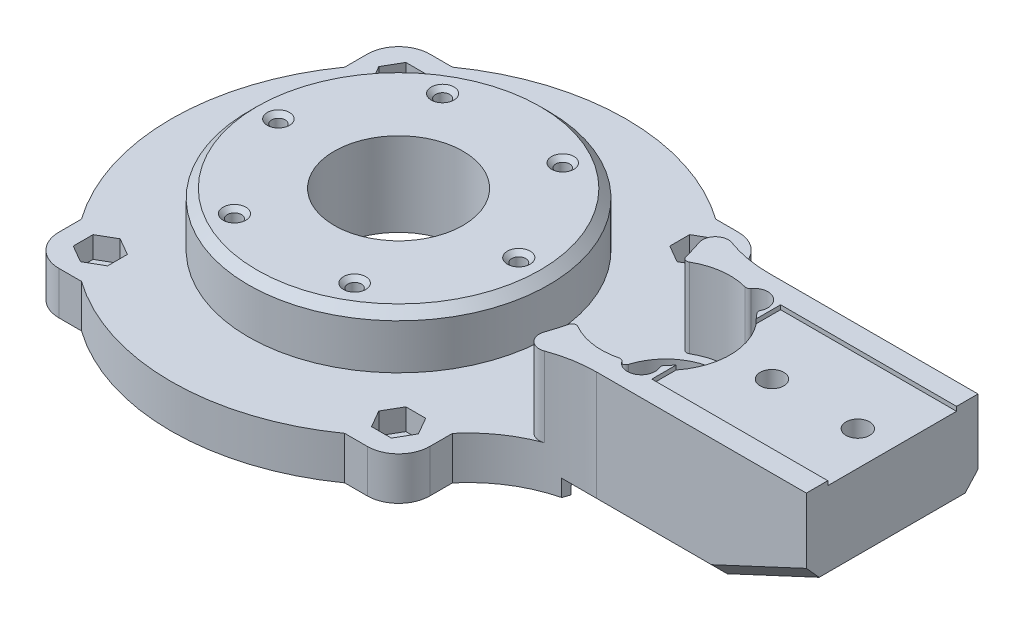
from build123d import *

# Parameters (mm, degrees)
SKETCH3_R           = 62.5
BOSS_EXTRUDE3_DEPTH = 10
BOSS_EXTRUDE4_START = -10
BOSS_EXTRUDE4_DEPTH = 10
BOSS_EXTRUDE5_DEPTH = 18.5
CHAMFER1_SIZE       = 10
CHAMFER1_SIZE2      = 21.445069205095713
SKETCH21_R          = 13.000000000000044
CUT_EXTRUDE12_DEPTH = 65.99999999999999
CUT_EXTRUDE14_DEPTH = 41
SKETCH26_R          = 2.750000000000008
CUT_EXTRUDE15_DEPTH = 134.9533500887529
SKETCH27_R          = 4.600000000000013
SKETCH27_R_2        = 4.5999999999999845
CUT_EXTRUDE16_DEPTH = 14
CHAMFER3_SIZE       = 3
SKETCH43_R          = 1.7499999999999962
SKETCH43_R_2        = 1.7499999999999967
SKETCH43_R_3        = 1.749999999999997
CUT_EXTRUDE22_DEPTH = 42.00000000000001
SKETCH44_R          = 3.000000000000008
CUT_EXTRUDE23_DEPTH = 4.99999999999998
SKETCH49_R          = 3.250000000000007
SKETCH49_R_2        = 3.250000000000008
CUT_EXTRUDE28_DEPTH = 23.000000000000007
FILLET4_R           = 1
CHAMFER6_SIZE       = 1
SKETCH53_R          = 35.00000000000001
BOSS_EXTRUDE7_DEPTH = 12.5
SKETCH54_R          = 2.750000000000002
CUT_EXTRUDE29_DEPTH = 134.953350156687
CHAMFER7_SIZE       = 2
FILLET6_R           = 1
SKETCH66_R          = 14.999999999999998
CUT_EXTRUDE39_DEPTH = 18.5
CUT_EXTRUDE40_DEPTH = 134.953350156687
FILLET8_R           = 30
FILLET9_R           = 3
FILLET10_R          = 1
SKETCH68_R          = 19.500000000000004
CUT_EXTRUDE41_DEPTH = 2
SKETCH70_R          = 37
CUT_EXTRUDE42_DEPTH = 3
SKETCH71_R          = 14.999999999999998
CUT_EXTRUDE43_DEPTH = 130.7931047448207
SKETCH73_R          = 1.6000000000000016
SKETCH73_R_2        = 1.6000000000000023
SKETCH73_R_3        = 1.600000000000003
CUT_EXTRUDE44_DEPTH = 6
SKETCH74_R          = 1.6499999999999986
CUT_EXTRUDE45_DEPTH = 129.60890341690967
CUT_EXTRUDE46_DEPTH = 14
CIRPATTERN1_COUNT   = 3
CHAMFER8_SIZE       = 1
CUT_EXTRUDE47_DEPTH = 5
CIRPATTERN2_COUNT   = 4
CHAMFER9_SIZE       = 1


with BuildPart() as part:
    # Sketch3 → Boss-Extrude3 (new body)
    with BuildSketch(Plane.XZ):
        with Locations(Location((0, 0, 0), (0, 0, 270))):
            Circle(SKETCH3_R)
    extrude(amount=BOSS_EXTRUDE3_DEPTH)

    # Sketch19 → Boss-Extrude4 (add)
    with BuildSketch(Plane.XZ.offset(10).offset(BOSS_EXTRUDE4_START)):
        with BuildLine():
            Line((59.21359641163505, -20), (115, -20))
            Line((115, -20), (115, 20))
            Line((115, 20), (59.21359641163505, 20))
            ThreePointArc((59.21359641163505, 20), (62.49999999999999, 0), (59.21359641163505, -20))
        make_face()
    extrude(amount=BOSS_EXTRUDE4_DEPTH)

    # Sketch20 → Boss-Extrude5 (add)
    with BuildSketch(Plane(origin=(0, 0, 0), x_dir=(1, 0, 0), z_dir=(0, 1, 0))):
        with BuildLine():
            Line((51.234753829797995, -20), (115, -20))
            Line((115, -20), (115, 20))
            Line((115, 20), (51.234753829797995, 20))
            ThreePointArc((51.234753829797995, 20), (55, 0), (51.234753829797995, -20))
        make_face()
    extrude(amount=BOSS_EXTRUDE5_DEPTH)

    # Chamfer1
    chamfer1_edges = [part.edges().sort_by_distance(p)[0] for p in [
        (115, -10, 0),
    ]]
    chamfer1_side = [part.faces().sort_by_distance(p)[0] for p in [
        (115, 4.249999999999999, -3e-17),
    ]]
    chamfer(chamfer1_edges, length=CHAMFER1_SIZE, length2=CHAMFER1_SIZE2, reference=chamfer1_side[0])

    # Sketch21 → Cut-Extrude12 (cut)
    with BuildSketch(Plane.XZ.offset(10)):
        with Locations(Location((62.250000000000114, -8.91e-15, 0), (0, 0, 270))):
            Circle(SKETCH21_R)
    extrude(amount=-CUT_EXTRUDE12_DEPTH, mode=Mode.SUBTRACT)

    # Sketch25 → Cut-Extrude14 (cut)
    with BuildSketch(Plane(origin=(115, 0, 0), x_dir=(0, 0, -1), z_dir=(1, 0, 0))):
        Polygon((15.00000000000001, 19.500000000000004), (-14.99999999999999, 19.499999999999996), (-14.99999999999999, 17.499999999999996), (15.00000000000001, 17.5), align=None)
    extrude(amount=-CUT_EXTRUDE14_DEPTH, mode=Mode.SUBTRACT)

    # Sketch26 → Cut-Extrude15 (cut, through all)
    with BuildSketch(Plane.XZ.offset(10)):
        with Locations(Location((107.00000000000001, 0, 0), (0, 0, 270))):
            Circle(SKETCH26_R)
        with Locations(Location((87.00000000000001, -3.43e-15, 0), (0, 0, 270))):
            Circle(SKETCH26_R)
    extrude(amount=-CUT_EXTRUDE15_DEPTH, mode=Mode.SUBTRACT)

    # Sketch27 → Cut-Extrude16 (cut)
    with BuildSketch(Plane.XZ.offset(10)):
        with Locations(Location((87.00000000000001, -3.43e-15, 0), (0, 0, 270))):
            Circle(SKETCH27_R)
        with Locations(Location((107.00000000000001, 0, 0), (0, 0, 270))):
            Circle(SKETCH27_R_2)
    extrude(amount=-CUT_EXTRUDE16_DEPTH, mode=Mode.SUBTRACT)

    # Chamfer3
    chamfer3_edges = [part.edges().sort_by_distance(p)[0] for p in [
        (76.38426360326967, -10, 20),
        (104.27746539745215, -5.000000000000005, 19.999999999999996),
        (104.27746539745215, -4.999999999999995, -20),
        (76.38426360326967, -10, -20),
    ]]
    chamfer(chamfer3_edges, length=CHAMFER3_SIZE)

    # Sketch43 → Cut-Extrude22 (cut)
    with BuildSketch(Plane.XZ.offset(15)):
        with Locations(Location((47.2508869107844, -0.16311510311927524, 0), (0, 0, 270))):
            Circle(SKETCH43_R)
        with Locations(Location((69.6080513242215, 13.071307536358828, 0), (0, 0, 270))):
            Circle(SKETCH43_R_2)
        with Locations(Location((69.89081836764976, -12.90805541793711, 0), (0, 0, 270))):
            Circle(SKETCH43_R_3)
    extrude(amount=-CUT_EXTRUDE22_DEPTH, mode=Mode.SUBTRACT)

    # Sketch44 → Cut-Extrude23 (cut)
    with BuildSketch(Plane(origin=(0, 0, 0), x_dir=(1, 0, 0), z_dir=(0, 1, 0))):
        with Locations((69.89081836764976, 12.90805541793711)):
            Circle(SKETCH44_R)
    extrude(amount=-CUT_EXTRUDE23_DEPTH, mode=Mode.SUBTRACT)

    # Sketch49 → Cut-Extrude28 (cut)
    with BuildSketch(Plane(origin=(0, 18.5, 0), x_dir=(1, 0, 0), z_dir=(0, 1, 0))):
        with Locations((69.6080513242215, -13.071307536358828)):
            Circle(SKETCH49_R)
        with Locations((47.2508869107844, 0.16311510311927524)):
            Circle(SKETCH49_R_2)
        with Locations((69.89081836764976, 12.90805541793711)):
            Circle(SKETCH49_R)
    extrude(amount=-CUT_EXTRUDE28_DEPTH, mode=Mode.SUBTRACT)

    # Fillet4
    fillet4_edges = [part.edges().sort_by_distance(p)[0] for p in [
        (49.49533004411492, -2.2500000000000036, -2.513641644395821),
        (49.443681399677665, -2.2500000000000036, 2.2356663228300255),
    ]]
    fillet(fillet4_edges, radius=FILLET4_R)

    # Chamfer6
    # the kernel refuses this chamfer: 1 mm, written as the material it takes off along each edge
    with BuildSketch(Plane(origin=(69.89081836764976, -4.999999999999979, -12.90805541793711), x_dir=(0, 0, -1), z_dir=(-1, 0, 0))) as chamfer6_piece_1:
        Polygon((1.7499999999999964 + CHAMFER6_SIZE, 8.9e-16), (1.7499999999999964, CHAMFER6_SIZE), (1.7499999999999964, 0), align=None)
    revolve(axis=Axis((69.89081836764976, -4.999999999999979, -12.90805541793711), (0, -1, 0)), mode=Mode.SUBTRACT)
    with BuildSketch(Plane(origin=(69.6080513242215, -4.500000000000007, 13.071307536358828), x_dir=(0, 0, -1), z_dir=(-1, 0, 0))) as chamfer6_piece_2:
        Polygon((1.7499999999999964, CHAMFER6_SIZE), (1.7499999999999964 + CHAMFER6_SIZE, 0), (1.7499999999999964, 0), align=None)
    revolve(axis=Axis((69.6080513242215, -4.500000000000007, 13.071307536358828), (0, -1, 0)), mode=Mode.SUBTRACT)
    with BuildSketch(Plane(origin=(47.2508869107844, -4.500000000000007, -0.16311510311927524), x_dir=(0, 0, -1), z_dir=(-1, 0, 0))) as chamfer6_piece_3:
        Polygon((1.7499999999999962 + CHAMFER6_SIZE, 0), (1.7499999999999962, CHAMFER6_SIZE), (1.7499999999999962, 0), align=None)
    revolve(axis=Axis((47.2508869107844, -4.500000000000007, -0.16311510311927524), (0, -1, 0)), mode=Mode.SUBTRACT)

    # Sketch53 → Boss-Extrude7 (add)
    with BuildSketch(Plane(origin=(0, 0, 0), x_dir=(1, 0, 0), z_dir=(0, 1, 0))):
        with Locations(Location((0, 0, 0), (0, 0, 90))):
            Circle(SKETCH53_R)
    extrude(amount=BOSS_EXTRUDE7_DEPTH)

    # Sketch54 → Cut-Extrude29 (cut, through all)
    with BuildSketch(Plane.XZ.offset(10)):
        with Locations(Location((-34.75000000000001, 34.75000000000001, 0), (0, 0, 270))):
            Circle(SKETCH54_R)
        with Locations(Location((34.74999999999999, 34.75000000000001, 0), (0, 0, 270))):
            Circle(SKETCH54_R)
        with Locations(Location((34.75, -34.74999999999999, 0), (0, 0, 270))):
            Circle(SKETCH54_R)
        with Locations(Location((-34.75, -34.74999999999999, 0), (0, 0, 270))):
            Circle(SKETCH54_R)
    extrude(amount=-CUT_EXTRUDE29_DEPTH, mode=Mode.SUBTRACT)

    # Chamfer7
    chamfer7_edges = [part.edges().sort_by_distance(p)[0] for p in [
        (-6.43e-15, 12.5, 35.00000000000001),
    ]]
    chamfer(chamfer7_edges, length=CHAMFER7_SIZE)

    # Fillet6
    fillet6_edges = [part.edges().sort_by_distance(p)[0] for p in [
        (66.45022837085345, 6.9999999999999964, 12.302767234759814),
        (70.58911742750864, 6.9999999999999964, 9.972919358453899),
        (70.80421249799967, 6.9999999999999964, -9.789047376485088),
        (66.71701547020479, 6.9999999999999964, -12.20843039825159),
    ]]
    fillet(fillet6_edges, radius=FILLET6_R)

    # Sketch66 → Cut-Extrude39 (cut)
    with BuildSketch(Plane(origin=(0, 18.5, 0), x_dir=(1, 0, 0), z_dir=(0, 1, 0))):
        with Locations((62.250000000000114, 8.91e-15)):
            Circle(SKETCH66_R)
    extrude(amount=-CUT_EXTRUDE39_DEPTH, mode=Mode.SUBTRACT)

    # Sketch67 → Cut-Extrude40 (cut, through all)
    with BuildSketch(Plane.XZ.offset(10)):
        with BuildLine():
            Line((-35.92500000000098, -43.22499999999998), (-30.669192604305767, -43.22499999999997))
            ThreePointArc((-30.669192604305767, -43.22499999999997), (3.25e-15, -53.00000000000001), (30.669192604305774, -43.22499999999997))
            Line((30.669192604305774, -43.22499999999997), (35.92499999999899, -43.22499999999997))
            ThreePointArc((35.92499999999899, -43.22499999999997), (41.086879502661006, -41.0868795026617), (43.224999999999035, -35.9249999999997))
            Line((43.224999999999035, -35.9249999999997), (43.224999999999035, -30.669192604307092))
            ThreePointArc((43.224999999999035, -30.669192604307092), (46.460557384610766, -25.503266604717343), (49.08156476723212, -20))
            Line((49.08156476723212, -20), (59.21359641163505, -20))
            ThreePointArc((59.21359641163505, -20), (-62.49999999999999, 3.541e-14), (59.21359641163505, 19.99999999999999))
            Line((59.21359641163505, 19.99999999999999), (51.23475382979799, 19.999999999999993))
            Line((51.23475382979799, 19.999999999999993), (49.08156476723212, 20))
            ThreePointArc((49.08156476723212, 20), (46.460557384610766, 25.503266604717357), (43.224999999999035, 30.669192604307113))
            Line((43.224999999999035, 30.669192604307113), (43.22499999999903, 35.924999999999955))
            ThreePointArc((43.22499999999903, 35.924999999999955), (41.086879502660835, 41.08687950266181), (35.92499999999899, 43.2250000000001))
            Line((35.92499999999899, 43.2250000000001), (30.669192604305604, 43.225000000000094))
            ThreePointArc((30.669192604305604, 43.225000000000094), (-6.736e-14, 53.000000000000014), (-30.66919260430573, 43.225000000000016))
            Line((-30.66919260430573, 43.225000000000016), (-35.924999999999955, 43.22500000000001))
            ThreePointArc((-35.924999999999955, 43.22500000000001), (-41.0868795026618, 41.08687950266181), (-43.22500000000001, 35.92499999999996))
            Line((-43.22500000000001, 35.92499999999996), (-43.225, 30.669192604305746))
            ThreePointArc((-43.225, 30.669192604305746), (-53.00000000000002, 1.343e-14), (-43.225, -30.66919260430574))
            Line((-43.225, -30.66919260430574), (-43.225, -35.92499999999993))
            ThreePointArc((-43.225, -35.92499999999993), (-41.08687950266216, -41.08687950266141), (-35.92500000000098, -43.22499999999998))
        make_face()
    extrude(amount=-CUT_EXTRUDE40_DEPTH, mode=Mode.SUBTRACT)

    # Fillet8
    # the kernel refuses this fillet: 30 mm, written as the material it adds along each edge
    with BuildSketch(Plane(origin=(49.08156476723212, -10, 20), x_dir=(1, 0, -8.3e-16), z_dir=(0, 1, 0))) as fillet8_piece_1_section:
        with BuildLine():
            CenterArc((17.085097888961304, -30), FILLET8_R, 89.99999999999999, 49.88227411577493)
            ThreePointArc((-5.856564767233104, -10.669192604307112), (-2.621007382621362, -5.503266604717352), (0, 0))
            Line((0, 0), (17.085097888961315, 0))
        make_face()
    fillet8_piece_1 = extrude(amount=10, mode=Mode.PRIVATE)
    fillet8_piece_1 = fillet8_piece_1 & Plane(origin=(0, -5.680550563935277, 0), x_dir=(-1.8e-16, 0, -1), z_dir=(0, 1, 0)) * Cylinder(62.5, 89, mode=Mode.PRIVATE)
    add(fillet8_piece_1)
    with BuildSketch(Plane(origin=(49.08156476723212, -52.712744722403286, 19.999999999999993), x_dir=(1, 0, -4.2e-16), z_dir=(0, 1, 0))) as fillet8_piece_2_section:
        with BuildLine():
            CenterArc((17.085097888961315, -30), FILLET8_R, 90, 49.88227411577495)
            ThreePointArc((-5.8565647672331, -10.669192604307122), (-2.6210073826213596, -5.50326660471736), (0, 0))
            Line((0, 0), (17.085097888961315, 0))
        make_face()
    fillet8_piece_2 = extrude(amount=95.42548944480657, mode=Mode.PRIVATE)
    fillet8_piece_2 = fillet8_piece_2 - Plane(origin=(4.619e-14, -3.500000000000007, 8.9e-16), x_dir=(0.9315409787235998, 0, -0.36363636363636387), z_dir=(0, -1, 0)) * Cylinder(54.999999999999964, 260, mode=Mode.PRIVATE)
    fillet8_piece_2 = split(fillet8_piece_2, bisect_by=Plane(origin=(62.501074038301326, -5.167833791174081, 21.83216620882592), z_dir=(0, 0.7071067811865476, -0.7071067811865476)), keep=Keep.TOP, mode=Mode.PRIVATE)
    fillet8_piece_2 = split(fillet8_piece_2, bisect_by=Plane(origin=(62.501074038301326, 18.5, 20.164332417651845), z_dir=(0, -1, 0)), keep=Keep.TOP, mode=Mode.PRIVATE)
    add(fillet8_piece_2)
    with BuildSketch(Plane(origin=(49.081564767232116, -10, -20), x_dir=(-0.4811937095229696, 0, -0.8766142902756742), z_dir=(0, 1, 0))) as fillet8_piece_3_section:
        with BuildLine():
            CenterArc((18.077187077517884, -29.41285224591131), FILLET8_R, 101.35433176263136, 49.88227411577485)
            Line((-8.221241630752342, -14.977040960222222), (0, 0))
            ThreePointArc((0, 0), (6.085454414022773, -0.35052474549389256), (12.170908828045548, 2.7e-16))
        make_face()
    fillet8_piece_3 = extrude(amount=10, mode=Mode.PRIVATE)
    fillet8_piece_3 = fillet8_piece_3 & Plane(origin=(0, -5, 0), x_dir=(-1.8e-16, 0, -1), z_dir=(0, 1, 0)) * Cylinder(62.5, 80, mode=Mode.PRIVATE)
    add(fillet8_piece_3)
    with BuildSketch(Plane(origin=(49.081564767232116, -52.71274472240323, -20.000000000000004), x_dir=(-0.48119370952296975, 0, -0.8766142902756742), z_dir=(0, 1, 0))) as fillet8_piece_4_section:
        with BuildLine():
            CenterArc((18.077187077517877, -29.412852245911314), FILLET8_R, 101.35433176263135, 49.88227411577486)
            Line((-8.221241630752347, -14.97704096022222), (0, 0))
            ThreePointArc((0, 0), (6.08545441402277, -0.3505247454938918), (12.170908828045546, 2e-16))
        make_face()
    fillet8_piece_4 = extrude(amount=95.42548944480646, mode=Mode.PRIVATE)
    fillet8_piece_4 = split(fillet8_piece_4, bisect_by=Plane(origin=(62.501074038301326, -5.167833791174077, -21.832166208825925), z_dir=(0, 0.7071067811865476, 0.7071067811865476)), keep=Keep.TOP, mode=Mode.PRIVATE)
    fillet8_piece_4 = fillet8_piece_4 - Plane(origin=(4.619e-14, -3.500000000000007, 8.9e-16), x_dir=(0.9315409787235998, 0, -0.36363636363636387), z_dir=(0, -1, 0)) * Cylinder(54.999999999999964, 251, mode=Mode.PRIVATE)
    fillet8_piece_4 = split(fillet8_piece_4, bisect_by=Plane(origin=(62.501074038301326, 18.5, -20.164332417651853), z_dir=(0, -1, 0)), keep=Keep.TOP, mode=Mode.PRIVATE)
    add(fillet8_piece_4)

    # Fillet9
    fillet9_edges = [part.edges().sort_by_distance(p)[0] for p in [
        (48.65847166346961, 9.25, -25.638898872130284),
        (48.65847166347005, 9.25, 25.638898872129463),
    ]]
    fillet(fillet9_edges, radius=FILLET9_R)

    # Fillet10
    fillet10_edges = [part.edges().sort_by_distance(p)[0] for p in [
        (72.25079007464825, 9.25, 11.17963317299897),
        (66.61989294218711, 9.25, 14.349356629264742),
        (53.61495983935745, 9.25, 12.265238743053008),
        (53.614959839357454, 9.25, -12.26523874305303),
        (66.93118593376231, 9.25, -14.25084201910705),
        (72.49175682816868, 9.25, -10.959307326316875),
    ]]
    fillet(fillet10_edges, radius=FILLET10_R)

    # Sketch68 → Cut-Extrude41 (cut)
    with BuildSketch(Plane.XZ.offset(10)):
        with Locations((62.250000000000114, -8.91e-15)):
            Circle(SKETCH68_R)
    extrude(amount=-CUT_EXTRUDE41_DEPTH, mode=Mode.SUBTRACT)

    # Sketch70 → Cut-Extrude42 (cut)
    with BuildSketch(Plane.XZ.offset(10)):
        with Locations(Location((0, 0, 0), (0, 0, 270))):
            Circle(SKETCH70_R)
    extrude(amount=-CUT_EXTRUDE42_DEPTH, mode=Mode.SUBTRACT)

    # Sketch71 → Cut-Extrude43 (cut, through all)
    with BuildSketch(Plane.XZ.offset(10)):
        with Locations(Location((0, 0, 0), (0, 0, 270))):
            Circle(SKETCH71_R)
    extrude(amount=-CUT_EXTRUDE43_DEPTH, mode=Mode.SUBTRACT)

    # Sketch73 → Cut-Extrude44 (cut)
    with BuildSketch(Plane(origin=(0, 12.5, 0), x_dir=(1, 0, 0), z_dir=(0, 1, 0))):
        with Locations(Location((-28, 0, 0), (0, 0, 270))):
            Circle(SKETCH73_R)
        with Locations(Location((14.000000000000114, 24.24871130596422, 0), (0, 0, 270))):
            Circle(SKETCH73_R_2)
        with Locations(Location((13.999999999999773, -24.24871130596442, 0), (0, 0, 270))):
            Circle(SKETCH73_R_3)
    extrude(amount=-CUT_EXTRUDE44_DEPTH, mode=Mode.SUBTRACT)

    # Sketch74 → Cut-Extrude45 (cut, through all)
    with BuildSketch(Plane(origin=(0, 12.5, 0), x_dir=(1, 0, 0), z_dir=(0, 1, 0))):
        with Locations(Location((-13.999999999999947, 24.248711305964314, 0), (0, 0, 270))):
            Circle(SKETCH74_R)
    cut_extrude45 = extrude(amount=-CUT_EXTRUDE45_DEPTH, mode=Mode.SUBTRACT)

    # Sketch75 → Cut-Extrude46 (cut)
    with BuildSketch(Plane.XZ.offset(10)):
        Polygon((-15.548355314671403, -27.02106214106112), (-12.37325140593884, -26.97580176010285), (-10.824896091267378, -24.203450925006038), (-12.451644685328487, -21.4763604708675), (-15.62674859406105, -21.521620851825773), (-17.175103908732513, -24.293971686922585), align=None)
    cut_extrude46 = extrude(amount=-CUT_EXTRUDE46_DEPTH, mode=Mode.SUBTRACT)

    # CirPattern1: Cut-Extrude45, Cut-Extrude46 ×3 about axis
    cirpattern1_axis = Axis((1.85e-15, 0, 4.1e-16), (0, 1, 0))
    add([cut_extrude45.rotate(cirpattern1_axis, i * 360 / CIRPATTERN1_COUNT) for i in range(1, CIRPATTERN1_COUNT)], mode=Mode.SUBTRACT)
    add([cut_extrude46.rotate(cirpattern1_axis, i * 360 / CIRPATTERN1_COUNT) for i in range(1, CIRPATTERN1_COUNT)], mode=Mode.SUBTRACT)

    # Chamfer8
    chamfer8_edges = [part.edges().sort_by_distance(p)[0] for p in [
        (-28, 12.5, -1.6000000000000016),
        (14.000000000000114, 12.5, -25.848711305964223),
        (13.999999999999773, 12.5, 22.64871130596442),
        (-13.999999999999947, 12.5, -25.898711305964312),
        (29.428941916244327, 12.5, 0.8250000000000747),
        (-15.428941916244378, 12.5, 25.07371130596425),
    ]]
    chamfer(chamfer8_edges, length=CHAMFER8_SIZE)

    # Sketch76 → Cut-Extrude47 (cut)
    with BuildSketch(Plane(origin=(0, 0, 0), x_dir=(1, 0, 0), z_dir=(0, 1, 0))):
        Polygon((-34.75000000000001, -39.36880215351702), (-30.750000000000007, -37.05940107675851), (-30.75000000000001, -32.44059892324151), (-34.75000000000002, -30.131197846483), (-38.75000000000002, -32.440598923241495), (-38.75000000000002, -37.05940107675851), align=None)
    cut_extrude47 = extrude(amount=-CUT_EXTRUDE47_DEPTH, mode=Mode.SUBTRACT)

    # CirPattern2: Cut-Extrude47 ×4 about axis
    cirpattern2_axis = Axis((-3.9e-16, 0, 1.1e-16), (0, 1, 0))
    for i in range(1, CIRPATTERN2_COUNT):
        add(cut_extrude47.rotate(cirpattern2_axis, i * 360 / CIRPATTERN2_COUNT), mode=Mode.SUBTRACT)

    # Chamfer9
    chamfer9_edges = [part.edges().sort_by_distance(p)[0] for p in [
        (-34.75, -10, -31.99999999999999),
        (34.75, -10, -31.99999999999999),
        (34.74999999999999, -10, 37.50000000000001),
        (-34.75000000000001, -10, 37.50000000000001),
    ]]
    chamfer(chamfer9_edges, length=CHAMFER9_SIZE)


solid = part.part
